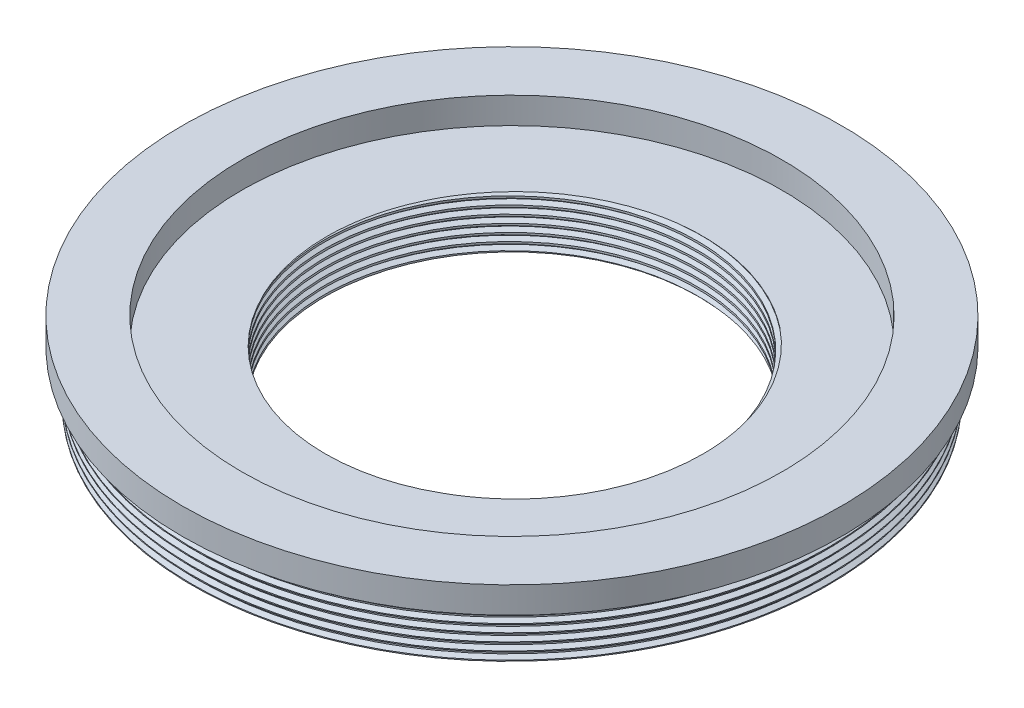
from build123d import *

# Parameters (mm, degrees)
SKETCH1_R                     = 23.8
BOSS_EXTRUDE1_DEPTH           = 12.7
MINCOLWIDTH_ONTRACKING1_PITCH = 0.6
CUT_EXTRUDE2_DEPTH            = 37.404703761
CUT_EXTRUDE2_DEPTH_BACK       = 37.404703761
SKETCH2_OUTSIDE_W             = 64.148
SKETCH2_OUTSIDE_H             = 29.048
SKETCH2_OUTSIDE_W_2           = 50
SKETCH2_OUTSIDE_H_2           = 3.81
SKETCH3_R                     = 25
BOSS_EXTRUDE2_DEPTH           = 2
SKETCH4_R                     = 20.5
CUT_EXTRUDE3_DEPTH            = 2
SKETCH5_R                     = 14.15
CUT_EXTRUDE4_DEPTH            = 36.560035303
THREAD1_PITCH                 = 0.6


with BuildPart() as part:
    # Sketch1 → Boss-Extrude1 (new body)
    with BuildSketch(Plane(origin=(0, 0, 0), x_dir=(1, 0, 0), z_dir=(0, 1, 0))):
        with Locations(Location((0, 0, 0), (0, 0, 270))):
            Circle(SKETCH1_R)
    extrude(amount=BOSS_EXTRUDE1_DEPTH)

    # MinColWidth_OnTracking1: the profile of HeaderRowsCount1 profile screwed along a right-hand helix of 21.166667 turns, 6 arcs to a turn; built about Z, then put on its axis
    mincolwidth_ontracking1_z = Axis((0, 0, 0), (0, 0, 1))
    mincolwidth_ontracking1_corners = [(23.7997, 0, -0.000173205), (24.124759525, 0, 0.187499999), (24.124759525, 0, 0.262499999), (23.7997, 0, 0.450173203)]
    with BuildLine(mode=Mode.PRIVATE) as mincolwidth_ontracking1_profile:
        Line(mincolwidth_ontracking1_corners[0], mincolwidth_ontracking1_corners[1])
        Line(mincolwidth_ontracking1_corners[1], mincolwidth_ontracking1_corners[2])
        Line(mincolwidth_ontracking1_corners[2], mincolwidth_ontracking1_corners[3])
        Line(mincolwidth_ontracking1_corners[3], mincolwidth_ontracking1_corners[0])
    mincolwidth_ontracking1_cap = Face(mincolwidth_ontracking1_profile.wire())
    mincolwidth_ontracking1_turn_angles = [0, 30, 60, 90, 120, 150, 180, 210, 240, 270, 300, 330, 360]
    mincolwidth_ontracking1_turn_weights = [1, 0.8660254037844387, 1, 0.8660254037844387, 1, 0.8660254037844387, 1, 0.8660254037844387, 1, 0.8660254037844387, 1, 0.8660254037844387, 1]
    mincolwidth_ontracking1_turn_rails = [Edge.make_bspline([Vector(p[0], p[1], 0).rotate(mincolwidth_ontracking1_z, mincolwidth_ontracking1_turn_angles[k]) / mincolwidth_ontracking1_turn_weights[k] + Vector(0, 0, p[2] + MINCOLWIDTH_ONTRACKING1_PITCH * mincolwidth_ontracking1_turn_angles[k] / 360) for k in range(13)], [0, 0, 0, 1, 1, 2, 2, 3, 3, 4, 4, 5, 5, 6, 6, 6], 2, mincolwidth_ontracking1_turn_weights) for p in mincolwidth_ontracking1_corners]
    mincolwidth_ontracking1_turn_sides = [Face.make_surface_from_curves(mincolwidth_ontracking1_turn_rails[p[0]], mincolwidth_ontracking1_turn_rails[p[1]]) for p in [(0, 1), (1, 2), (2, 3), (3, 0)]]
    mincolwidth_ontracking1_last_angles = [7560, 7590, 7620]
    mincolwidth_ontracking1_last_weights = [1, 0.8660254037844387, 1]
    mincolwidth_ontracking1_last_rails = [Edge.make_bspline([Vector(p[0], p[1], 0).rotate(mincolwidth_ontracking1_z, mincolwidth_ontracking1_last_angles[k]) / mincolwidth_ontracking1_last_weights[k] + Vector(0, 0, p[2] + MINCOLWIDTH_ONTRACKING1_PITCH * mincolwidth_ontracking1_last_angles[k] / 360) for k in range(3)], [0, 0, 0, 1, 1, 1], 2, mincolwidth_ontracking1_last_weights) for p in mincolwidth_ontracking1_corners]
    mincolwidth_ontracking1_last_sides = [Face.make_surface_from_curves(mincolwidth_ontracking1_last_rails[p[0]], mincolwidth_ontracking1_last_rails[p[1]]) for p in [(0, 1), (1, 2), (2, 3), (3, 0)]]
    mincolwidth_ontracking1 = Plane(origin=(0, 12.7, 0), x_dir=(-1, 0, 0), z_dir=(0, -1, 0)) * Solid(Shell([*[p.moved(Location((0, 0, MINCOLWIDTH_ONTRACKING1_PITCH * i))) for i in range(21) for p in mincolwidth_ontracking1_turn_sides], *mincolwidth_ontracking1_last_sides, mincolwidth_ontracking1_cap, mincolwidth_ontracking1_cap.rotate(mincolwidth_ontracking1_z, 7620).moved(Location((0, 0, MINCOLWIDTH_ONTRACKING1_PITCH * 7620 / 360)))]))
    add(mincolwidth_ontracking1)

    # Sketch2 outside → Cut-Extrude2 (cut, two sides: drawn at the far end of the back side and taken through both)
    with BuildSketch(Plane.XY.offset(-CUT_EXTRUDE2_DEPTH_BACK)):
        with Locations((0, 6.125)):
            Rectangle(SKETCH2_OUTSIDE_W, SKETCH2_OUTSIDE_H)
        with Locations((0, 6)):
            Rectangle(SKETCH2_OUTSIDE_W_2, SKETCH2_OUTSIDE_H_2, mode=Mode.SUBTRACT)
    extrude(amount=CUT_EXTRUDE2_DEPTH + CUT_EXTRUDE2_DEPTH_BACK, mode=Mode.SUBTRACT)

    # Sketch3 → Boss-Extrude2 (add)
    with BuildSketch(Plane(origin=(0, 7.905, 0), x_dir=(1, 0, 0), z_dir=(0, 1, 0))):
        with Locations(Location((0, 0, 0), (0, 0, 270))):
            Circle(SKETCH3_R)
    extrude(amount=BOSS_EXTRUDE2_DEPTH)

    # Sketch4 → Cut-Extrude3 (cut)
    with BuildSketch(Plane(origin=(0, 9.905, 0), x_dir=(1, 0, 0), z_dir=(0, 1, 0))):
        with Locations(Location((0, 0, 0), (0, 0, 270))):
            Circle(SKETCH4_R)
    extrude(amount=-CUT_EXTRUDE3_DEPTH, mode=Mode.SUBTRACT)

    # Sketch5 → Cut-Extrude4 (cut, through all)
    with BuildSketch(Plane(origin=(0, 7.905, 0), x_dir=(1, 0, 0), z_dir=(0, 1, 0))):
        with Locations(Location((0, 0, 0), (0, 0, 270))):
            Circle(SKETCH5_R)
    extrude(amount=-CUT_EXTRUDE4_DEPTH, mode=Mode.SUBTRACT)

    # Thread1: the profile of Thread Profile1 profile screwed along a right-hand helix of 16.666667 turns, 6 arcs to a turn; built about Z, then put on its axis
    thread1_z = Axis((0, 0, 0), (0, 0, 1))
    thread1_corners = [(14.1497, 0, -0.000173205), (14.474759525, 0, 0.187499999), (14.474759525, 0, 0.262499999), (14.1497, 0, 0.450173203)]
    with BuildLine(mode=Mode.PRIVATE) as thread1_profile:
        Line(thread1_corners[0], thread1_corners[1])
        Line(thread1_corners[1], thread1_corners[2])
        Line(thread1_corners[2], thread1_corners[3])
        Line(thread1_corners[3], thread1_corners[0])
    thread1_cap = Face(thread1_profile.wire())
    thread1_turn_angles = [0, 30, 60, 90, 120, 150, 180, 210, 240, 270, 300, 330, 360]
    thread1_turn_weights = [1, 0.8660254037844387, 1, 0.8660254037844387, 1, 0.8660254037844387, 1, 0.8660254037844387, 1, 0.8660254037844387, 1, 0.8660254037844387, 1]
    thread1_turn_rails = [Edge.make_bspline([Vector(p[0], p[1], 0).rotate(thread1_z, thread1_turn_angles[k]) / thread1_turn_weights[k] + Vector(0, 0, p[2] + THREAD1_PITCH * thread1_turn_angles[k] / 360) for k in range(13)], [0, 0, 0, 1, 1, 2, 2, 3, 3, 4, 4, 5, 5, 6, 6, 6], 2, thread1_turn_weights) for p in thread1_corners]
    thread1_turn_sides = [Face.make_surface_from_curves(thread1_turn_rails[p[0]], thread1_turn_rails[p[1]]) for p in [(0, 1), (1, 2), (2, 3), (3, 0)]]
    thread1_last_angles = [5760, 5790, 5820, 5850, 5880, 5910, 5940, 5970, 6000]
    thread1_last_weights = [1, 0.8660254037844387, 1, 0.8660254037844387, 1, 0.8660254037844387, 1, 0.8660254037844387, 1]
    thread1_last_rails = [Edge.make_bspline([Vector(p[0], p[1], 0).rotate(thread1_z, thread1_last_angles[k]) / thread1_last_weights[k] + Vector(0, 0, p[2] + THREAD1_PITCH * thread1_last_angles[k] / 360) for k in range(9)], [0, 0, 0, 1, 1, 2, 2, 3, 3, 4, 4, 4], 2, thread1_last_weights) for p in thread1_corners]
    thread1_last_sides = [Face.make_surface_from_curves(thread1_last_rails[p[0]], thread1_last_rails[p[1]]) for p in [(0, 1), (1, 2), (2, 3), (3, 0)]]
    thread1 = Plane(origin=(0, 11.905, 0), x_dir=(-1, 0, 0), z_dir=(0, -1, 0)) * Solid(Shell([*[p.moved(Location((0, 0, THREAD1_PITCH * i))) for i in range(16) for p in thread1_turn_sides], *thread1_last_sides, thread1_cap, thread1_cap.rotate(thread1_z, 6000).moved(Location((0, 0, THREAD1_PITCH * 6000 / 360)))]))
    add(thread1, mode=Mode.SUBTRACT)


solid = part.part
